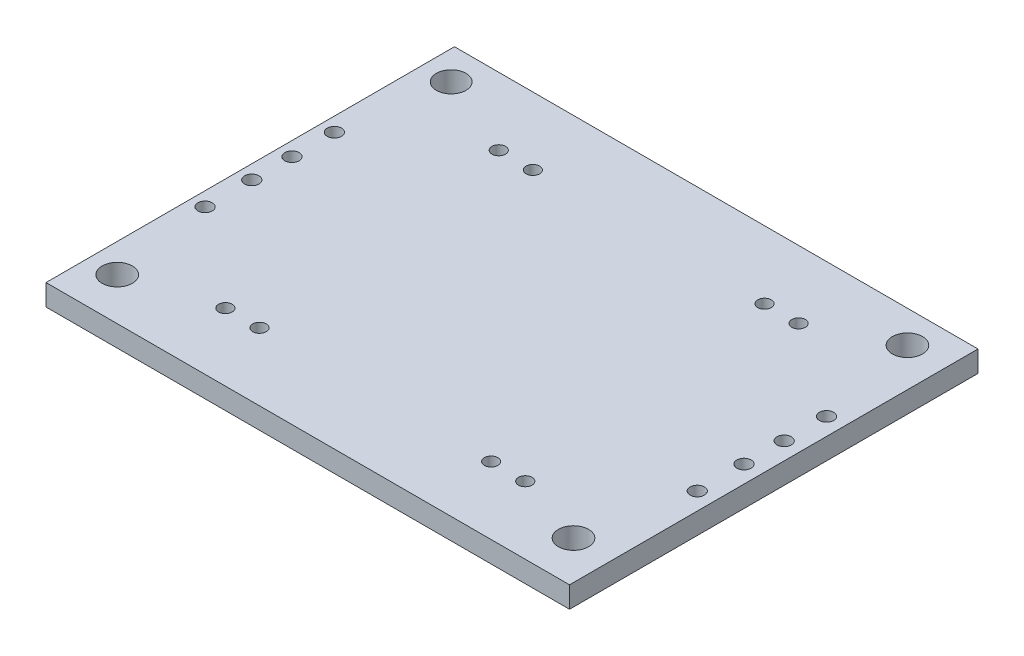
from build123d import *

# Parameters (mm, degrees)
SKETCH_1_W               = 30.85
SKETCH_1_H               = 24.07
EXTRUDE_1_DEPTH          = 1.25
CUT_EXTRUDE_1_DEPTH      = 11
CUT_EXTRUDE_1_DEPTH_BACK = 11
SKETCH_2_R               = 0.872176239
SKETCH_2_R_2             = 0.89
SKETCH_2_R_3             = 0.4


# Read off the part's stored shape, not the designer's step: 切除-拉伸2
with BuildPart() as part:
    # 草图1 → 凸台-拉伸1 (new body)
    with BuildSketch(Plane(origin=(0, 0, 0), x_dir=(1, 0, 0), z_dir=(0, 1, 0))):
        Rectangle(SKETCH_1_W, SKETCH_1_H)
    extrude(amount=EXTRUDE_1_DEPTH)

    # 草图2 → 切除-拉伸1 (cut, two sides: drawn at the far end of the back side and taken through both)
    with BuildSketch(Plane(origin=(0, 0, 0), x_dir=(1, 0, 0), z_dir=(0, 1, 0)).offset(-CUT_EXTRUDE_1_DEPTH_BACK)):
        with Locations(Location((-13.728729398, 10.145, 0), (0, 0, 270))):
            Circle(SKETCH_2_R)
        with Locations(Location((-13.728729398, -9.533026001, 0), (0, 0, 270))):
            Circle(SKETCH_2_R_2)
        with Locations(Location((13.15647485, -9.533026001, 0), (0, 0, 270))):
            Circle(SKETCH_2_R_2)
        with Locations(Location((13.15647485, 10.145, 0), (0, 0, 270))):
            Circle(SKETCH_2_R_2)
        with Locations(Location((-8.835, 8.055, 0), (0, 0, 270))):
            Circle(SKETCH_2_R_3)
        with Locations(Location((-6.825, 8.055, 0), (0, 0, 270))):
            Circle(SKETCH_2_R_3)
        with Locations(Location((6.825, 8.055, 0), (0, 0, 270))):
            Circle(SKETCH_2_R_3)
        with Locations(Location((8.835, 8.055, 0), (0, 0, 270))):
            Circle(SKETCH_2_R_3)
        with Locations(Location((-8.835, -8.055, 0), (0, 0, 270))):
            Circle(SKETCH_2_R_3)
        with Locations(Location((-6.825, -8.055, 0), (0, 0, 270))):
            Circle(SKETCH_2_R_3)
        with Locations(Location((6.825, -8.055, 0), (0, 0, 270))):
            Circle(SKETCH_2_R_3)
        with Locations(Location((8.835, -8.055, 0), (0, 0, 270))):
            Circle(SKETCH_2_R_3)
    extrude(amount=CUT_EXTRUDE_1_DEPTH + CUT_EXTRUDE_1_DEPTH_BACK, mode=Mode.SUBTRACT)

    # 切除-拉伸2 outline → 切除-拉伸2 (revolve, cut)
    with BuildSketch(Plane(origin=(14.403562721, 0, -4.132088396), x_dir=(1, 0, 0), z_dir=(0, 0, 1))):
        Polygon((0.421818831, 1.25), (0, 1.25), (0, 0), (0.4, 0), align=None)
    revolve(axis=Axis((14.403562721, 0, -4.132088396), (0, 1, 0)), mode=Mode.SUBTRACT)

    # Cut-Extrude 2 2 outline → Cut-Extrude 2 2 (revolve, cut)
    with BuildSketch(Plane(origin=(-14.599926989, 0, -4.132088396), x_dir=(1, 0, 0), z_dir=(0, 0, 1))):
        Polygon((0.421818831, 1.25), (0, 1.25), (0, 0), (0.4, 0), align=None)
    revolve(axis=Axis((-14.599926989, 0, -4.132088396), (0, 1, 0)), mode=Mode.SUBTRACT)

    # Cut-Extrude 2 3 outline → Cut-Extrude 2 3 (revolve, cut)
    with BuildSketch(Plane(origin=(14.403562721, 0, -1.635099216), x_dir=(1, 0, 0), z_dir=(0, 0, 1))):
        Polygon((0.421818831, 1.25), (0, 1.25), (0, 0), (0.4, 0), align=None)
    revolve(axis=Axis((14.403562721, 0, -1.635099216), (0, 1, 0)), mode=Mode.SUBTRACT)

    # Cut-Extrude 2 4 outline → Cut-Extrude 2 4 (revolve, cut)
    with BuildSketch(Plane(origin=(14.403562721, 0, 0.733839237), x_dir=(1, 0, 0), z_dir=(0, 0, 1))):
        Polygon((0.421818831, 1.25), (0, 1.25), (0, 0), (0.4, 0), align=None)
    revolve(axis=Axis((14.403562721, 0, 0.733839237), (0, 1, 0)), mode=Mode.SUBTRACT)

    # Cut-Extrude 2 5 outline → Cut-Extrude 2 5 (revolve, cut)
    with BuildSketch(Plane(origin=(14.403562721, 0, 3.486929872), x_dir=(1, 0, 0), z_dir=(0, 0, 1))):
        Polygon((0.421818831, 1.25), (0, 1.25), (0, 0), (0.4, 0), align=None)
    revolve(axis=Axis((14.403562721, 0, 3.486929872), (0, 1, 0)), mode=Mode.SUBTRACT)

    # Cut-Extrude 2 6 outline → Cut-Extrude 2 6 (revolve, cut)
    with BuildSketch(Plane(origin=(-14.599926989, 0, 3.486929872), x_dir=(1, 0, 0), z_dir=(0, 0, 1))):
        Polygon((0.421818831, 1.25), (0, 1.25), (0, 0), (0.4, 0), align=None)
    revolve(axis=Axis((-14.599926989, 0, 3.486929872), (0, 1, 0)), mode=Mode.SUBTRACT)

    # Cut-Extrude 2 7 outline → Cut-Extrude 2 7 (revolve, cut)
    with BuildSketch(Plane(origin=(-14.599926989, 0, 0.733839237), x_dir=(1, 0, 0), z_dir=(0, 0, 1))):
        Polygon((0.421818831, 1.25), (0, 1.25), (0, 0), (0.4, 0), align=None)
    revolve(axis=Axis((-14.599926989, 0, 0.733839237), (0, 1, 0)), mode=Mode.SUBTRACT)

    # Cut-Extrude 2 8 outline → Cut-Extrude 2 8 (revolve, cut)
    with BuildSketch(Plane(origin=(-14.599926989, 0, -1.635099216), x_dir=(1, 0, 0), z_dir=(0, 0, 1))):
        Polygon((0.421818831, 1.25), (0, 1.25), (0, 0), (0.4, 0), align=None)
    revolve(axis=Axis((-14.599926989, 0, -1.635099216), (0, 1, 0)), mode=Mode.SUBTRACT)


solid = part.part
